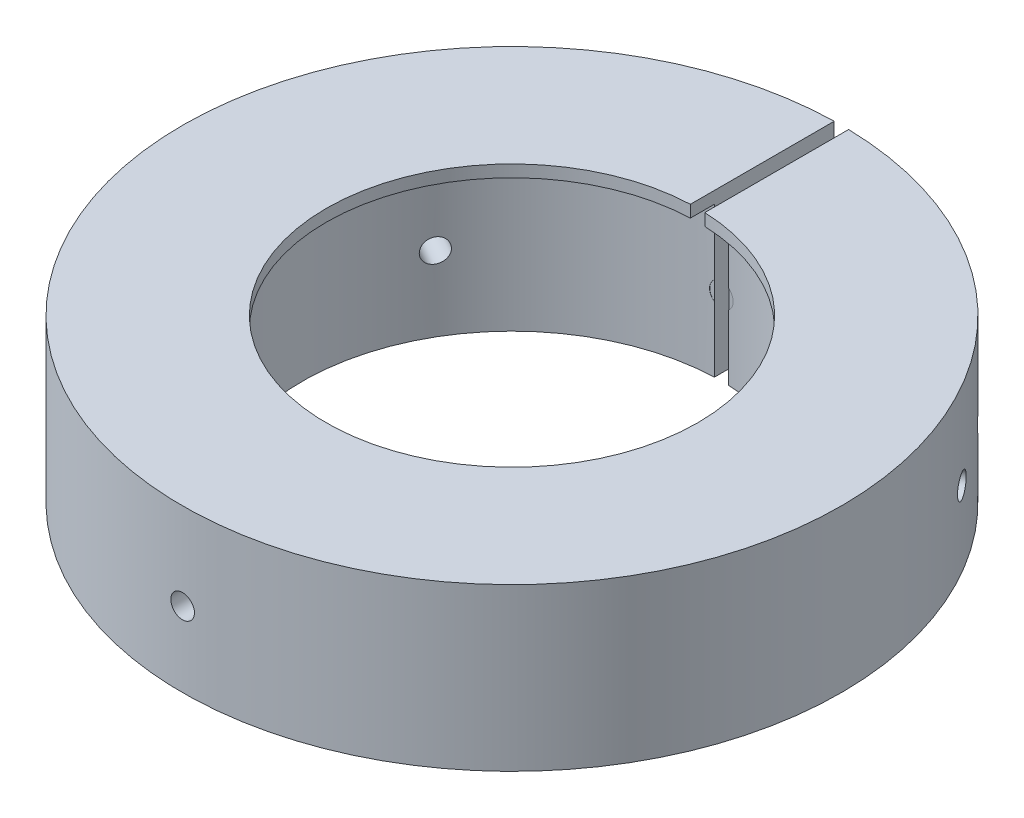
from build123d import *

# Parameters (mm, degrees)
BOSS_EXTRUDE1_DEPTH        = 7.9375
F_2_5MM_DOWEL_HOLE1_REACH  = 85.992
F_2_5MM_DOWEL_HOLE1_BORE_R = 1.25
CIRPATTERN1_START          = -22.212933302
CIRPATTERN1_DEPTH          = 57.137933384
CIRPATTERN1_START_2        = -34.9250001
CIRPATTERN1_2_OUTLINE_R    = 1.25
CIRPATTERN1_2_DEPTH        = 12.735179899
BOSS_EXTRUDE2_START        = 1.27
BOSS_EXTRUDE2_DEPTH        = 1.27


# Read off the part's stored shape, not the designer's step: CirPattern1
with BuildPart() as part:
    # Sketch1 → Boss-Extrude1 (new, symmetric)
    with BuildSketch(Plane(origin=(0, 0, 0), x_dir=(1, 0, 0), z_dir=(0, 1, 0))):
        with BuildLine():
            Line((-0.762, 34.916686283), (-0.762, 22.211933302))
            ThreePointArc((-0.762, 22.211933302), (0, -22.225), (0.762, 22.211933302))
            Line((0.762, 22.211933302), (0.762, 34.916686283))
            ThreePointArc((0.762, 34.916686283), (0, -34.925), (-0.762, 34.916686283))
        make_face()
    extrude(amount=BOSS_EXTRUDE1_DEPTH, both=True)

    # Sketch2 → Cut-Revolve1 (revolve, cut)
    with BuildSketch(Plane(origin=(0, 0, 0), x_dir=(1, 0, 0), z_dir=(0, 1, 0)), mode=Mode.PRIVATE) as cut_revolve1_sk:
        Polygon((-22.683703898, 26.5557), (0.762, 26.5557), (0.762, 26.0223), (5.329933657, 26.0223), (5.329933657, 23.8125), (25.548394641, 23.8125), (25.548394641, 28.575), (-22.683703898, 28.575), align=None)
    revolve(cut_revolve1_sk.sketch.rotate(Axis((-22.683703898, 0, -28.575), (-1, 0, 0)), 180), axis=Axis((-22.683703898, 0, -28.575), (-1, 0, 0)), mode=Mode.SUBTRACT)

    # Ø2.5mm Dowel Hole1 bore (on position points) → Ø2.5mm Dowel Hole1 (cut, up to next)
    with BuildSketch(Plane(origin=(30.245937227, 0, -17.4625), x_dir=(0.5, 0, 0.866025403784), z_dir=(0.866025403784, 0, -0.5)), mode=Mode.PRIVATE) as f_2_5mm_dowel_hole1_sk1:
        Circle(F_2_5MM_DOWEL_HOLE1_BORE_R)
    f_2_5mm_dowel_hole1_tool1 = extrude(f_2_5mm_dowel_hole1_sk1.sketch, amount=-F_2_5MM_DOWEL_HOLE1_REACH, mode=Mode.PRIVATE) & part.part
    add(f_2_5mm_dowel_hole1_tool1.solids().sort_by_distance((30.245937, 0, -17.4625))[0], mode=Mode.SUBTRACT)

    # CirPattern1 outline → CirPattern1 (cut)
    with BuildSketch(Plane.XY.offset(CIRPATTERN1_START)):
        with BuildLine():
            ThreePointArc((-0.762, -0.990886472), (1.25, 0), (-0.762, 0.990886472))
            ThreePointArc((-0.762, 0.990886472), (-1.25, 0), (-0.762, -0.990886472))
        make_face()
    extrude(amount=CIRPATTERN1_DEPTH, mode=Mode.SUBTRACT)

    # CirPattern1 2 outline → CirPattern1 2 (cut)
    with BuildSketch(Plane(origin=(0, 0, 0), x_dir=(0.500000000000004, 0, -0.8660254037844363), z_dir=(0.8660254037844363, 0, 0.5000000000000042)).offset(CIRPATTERN1_START_2)):
        Circle(CIRPATTERN1_2_OUTLINE_R)
    extrude(amount=CIRPATTERN1_2_DEPTH, mode=Mode.SUBTRACT)

    # Sketch4 → Boss-Extrude2 (add)
    with BuildSketch(Plane(origin=(0, 7.9375, 0), x_dir=(1, 0, 0), z_dir=(0, 1, 0)).offset(BOSS_EXTRUDE2_START)):
        with BuildLine():
            Line((0.762, 34.916686283), (0.762, 19.670246084))
            ThreePointArc((0.762, 19.670246084), (0, -19.685), (-0.762, 19.670246084))
            Line((-0.762, 19.670246084), (-0.762, 34.916686283))
            ThreePointArc((-0.762, 34.916686283), (0, -34.925), (0.762, 34.916686283))
        make_face()
    extrude(amount=-BOSS_EXTRUDE2_DEPTH)


solid = part.part
